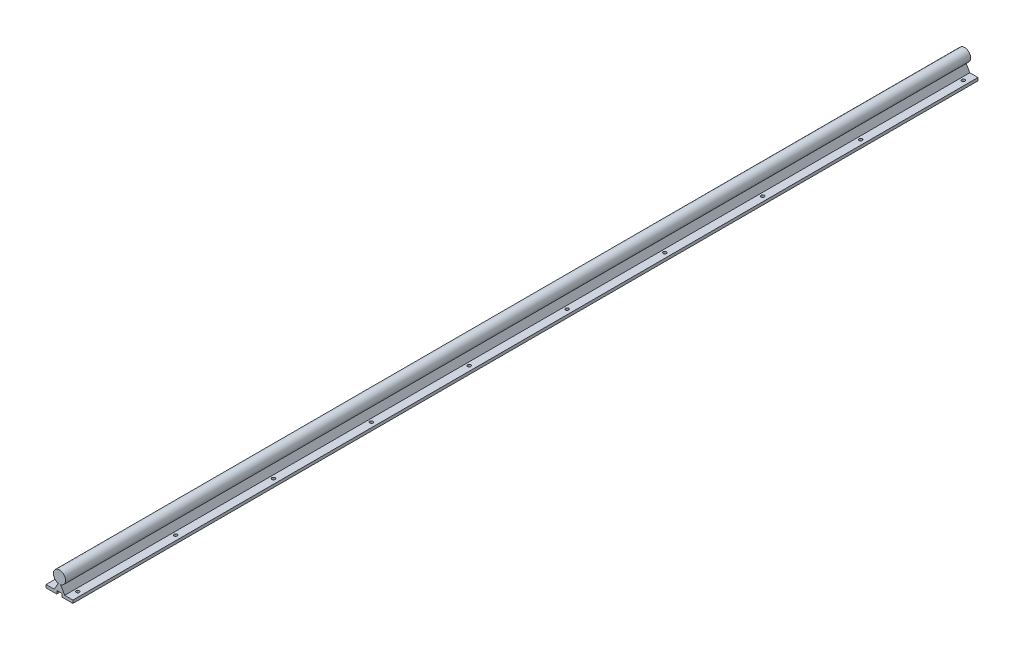
from build123d import *

# Parameters (mm, degrees)
BOSS_EXTRUDE1_DEPTH     = 1850
CHAMFER1_SIZE           = 1
CUT_EXTRUDE1_DEPTH      = 1851.625975177
CUT_EXTRUDE1_DEPTH_BACK = 1851.625975177
SKETCH2_R               = 3.3


with BuildPart() as part:
    # Sketch1 → Boss-Extrude1 (new body)
    with BuildSketch(Plane.XY):
        with BuildLine():
            Line((-27.5, 6), (-27.5, 0))
            Line((-27.5, 0), (-4.75, 0))
            Line((-4.75, 0), (-4.75, 6.5))
            Line((-4.75, 6.5), (4.75, 6.5))
            Line((4.75, 6.5), (4.75, 0))
            Line((4.75, 0), (27.5, 0))
            Line((27.5, 0), (27.5, 6))
            Line((27.5, 6), (10.75, 6))
            Line((10.75, 6), (2.259535401, 20.705916066))
            ThreePointArc((2.259535401, 20.705916066), (0, 45.5), (-2.259535401, 20.705916066))
            Line((-2.259535401, 20.705916066), (-10.75, 6))
            Line((-10.75, 6), (-27.5, 6))
        make_face()
    extrude(amount=-BOSS_EXTRUDE1_DEPTH)

    # Chamfer1
    chamfer1_edges = [part.edges().sort_by_distance(p)[0] for p in [
        (-4.75, 0, -925),
        (4.75, 0, -925),
    ]]
    chamfer(chamfer1_edges, length=CHAMFER1_SIZE)

    # Sketch2 → Cut-Extrude1 (cut, two sides: drawn at the far end of the back side and taken through both)
    with BuildSketch(Plane(origin=(0, 6, 0), x_dir=(1, 0, 0), z_dir=(0, 1, 0)).offset(-CUT_EXTRUDE1_DEPTH_BACK)):
        with Locations((17.5, 20)):
            Circle(SKETCH2_R)
        with Locations((-17.5, 20)):
            Circle(SKETCH2_R)
        with Locations((-17.5, 220)):
            Circle(SKETCH2_R)
        with Locations((17.5, 220)):
            Circle(SKETCH2_R)
        with Locations((-17.5, 420)):
            Circle(SKETCH2_R)
        with Locations((17.5, 420)):
            Circle(SKETCH2_R)
        with Locations((-17.5, 620)):
            Circle(SKETCH2_R)
        with Locations((17.5, 620)):
            Circle(SKETCH2_R)
        with Locations((-17.5, 820)):
            Circle(SKETCH2_R)
        with Locations((17.5, 820)):
            Circle(SKETCH2_R)
        with Locations((-17.5, 1020)):
            Circle(SKETCH2_R)
        with Locations((17.5, 1020)):
            Circle(SKETCH2_R)
        with Locations((-17.5, 1220)):
            Circle(SKETCH2_R)
        with Locations((17.5, 1220)):
            Circle(SKETCH2_R)
        with Locations((-17.5, 1420)):
            Circle(SKETCH2_R)
        with Locations((17.5, 1420)):
            Circle(SKETCH2_R)
        with Locations((-17.5, 1620)):
            Circle(SKETCH2_R)
        with Locations((17.5, 1620)):
            Circle(SKETCH2_R)
        with Locations((17.5, 1830)):
            Circle(SKETCH2_R)
        with Locations((-17.5, 1830)):
            Circle(SKETCH2_R)
    extrude(amount=CUT_EXTRUDE1_DEPTH + CUT_EXTRUDE1_DEPTH_BACK, mode=Mode.SUBTRACT)


solid = part.part
